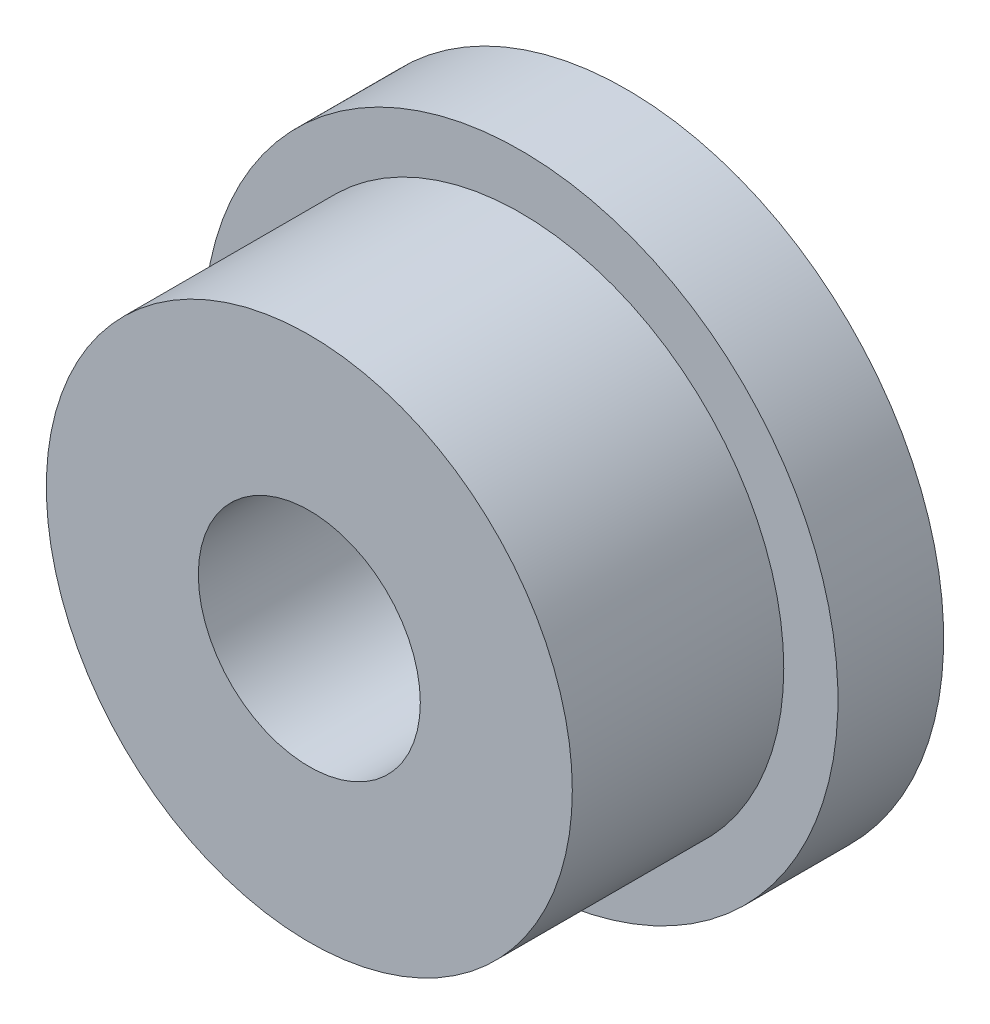
from build123d import *

# Parameters (mm, degrees)
SKETCH_1_R          = 4.975
EXTRUDE_1_DEPTH     = 4
SKETCH_2_R          = 6
EXTRUDE_2_DEPTH     = 2
SKETCH_3_R          = 2.1
CUT_EXTRUDE_1_DEPTH = 11.392304845
SKETCH_4_R          = 4
CUT_EXTRUDE_2_DEPTH = 3


with BuildPart() as part:
    # ｽｹｯﾁ1 → ﾎﾞｽ - 押し出し1 (new body)
    with BuildSketch(Plane.XY):
        Circle(SKETCH_1_R)
    extrude(amount=EXTRUDE_1_DEPTH)

    # ｽｹｯﾁ2 → ﾎﾞｽ - 押し出し2 (add)
    with BuildSketch(Plane(origin=(0, 0, 0), x_dir=(-1, 0, 0), z_dir=(0, 0, -1))):
        Circle(SKETCH_2_R)
    extrude(amount=EXTRUDE_2_DEPTH)

    # ｽｹｯﾁ3 → ｶｯﾄ - 押し出し1 (cut, through all)
    with BuildSketch(Plane.XY.offset(4)):
        Circle(SKETCH_3_R)
    extrude(amount=-CUT_EXTRUDE_1_DEPTH, mode=Mode.SUBTRACT)

    # ｽｹｯﾁ4 → ｶｯﾄ - 押し出し2 (cut)
    with BuildSketch(Plane(origin=(0, 0, -2), x_dir=(-1, 0, 0), z_dir=(0, 0, -1))):
        Circle(SKETCH_4_R)
    extrude(amount=-CUT_EXTRUDE_2_DEPTH, mode=Mode.SUBTRACT)


solid = part.part
